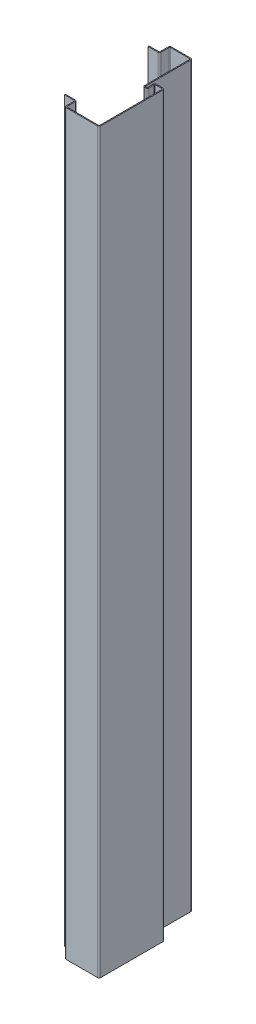
from build123d import *

# Parameters (mm, degrees)
BASE_FLANGE1_DEPTH = 490.75


# Sheet-metal steps are written as plain solids
with BuildPart() as part:
    # Sketch1 → Base-Flange1 (new, symmetric)
    with BuildSketch(Plane(origin=(0, 0, 0), x_dir=(1, 0, 0), z_dir=(0, 1, 0))):
        with BuildLine():
            Line((-4.25, 57.25), (8.7634, 57.25))
            ThreePointArc((8.7634, 57.25), (9.284254855, 57.465745145), (9.5, 57.9866))
            Line((9.5, 57.9866), (9.5, 69.0134))
            ThreePointArc((9.5, 69.0134), (10.081861668, 70.418138332), (11.4866, 71))
            Line((11.4866, 71), (37.5134, 71))
            ThreePointArc((37.5134, 71), (38.918138332, 70.418138332), (39.5, 69.0134))
            Line((39.5, 69.0134), (39.5, 17))
            Line((39.5, 17), (39.5, 8.562771629))
            ThreePointArc((39.5, 8.562771629), (39.724914644, 8.032905932), (40.262306969, 7.826620346))
            Line((40.262306969, 7.826620346), (42.153527557, 7.892663224))
            ThreePointArc((42.153527557, 7.892663224), (42.675221066, 8.135932903), (42.862626267, 8.680197126))
            Line((42.862626267, 8.680197126), (42.359529101, 15.874821789))
            ThreePointArc((42.359529101, 15.874821789), (42.88838258, 17.368257942), (44.341289843, 18))
            Line((44.341289843, 18), (53.5134, 18))
            ThreePointArc((53.5134, 18), (54.918138332, 17.418138332), (55.5, 16.0134))
            Line((55.5, 16.0134), (55.5, -22))
            Line((55.5, -22), (55.5, -67.0134))
            ThreePointArc((55.5, -67.0134), (54.918138332, -68.418138332), (53.5134, -69))
            Line((53.5134, -69), (39.5, -69))
            Line((39.5, -69), (11.4866, -69))
            ThreePointArc((11.4866, -69), (10.081861668, -68.418138332), (9.5, -67.0134))
            Line((9.5, -67.0134), (9.5, -55.9866))
            ThreePointArc((9.5, -55.9866), (9.284254855, -55.465745145), (8.7634, -55.25))
            Line((8.7634, -55.25), (-4.25, -55.25))
            Line((-4.25, -55.25), (-4.25, -54))
            Line((-4.25, -54), (8.7634, -54))
            ThreePointArc((8.7634, -54), (10.168138332, -54.581861668), (10.75, -55.9866))
            Line((10.75, -55.9866), (10.75, -67.0134))
            ThreePointArc((10.75, -67.0134), (10.965745145, -67.534254855), (11.4866, -67.75))
            Line((11.4866, -67.75), (39.5, -67.75))
            Line((39.5, -67.75), (53.5134, -67.75))
            ThreePointArc((53.5134, -67.75), (54.034254855, -67.534254855), (54.25, -67.0134))
            Line((54.25, -67.0134), (54.25, -22))
            Line((54.25, -22), (54.25, 16.0134))
            ThreePointArc((54.25, 16.0134), (54.034254855, 16.534254855), (53.5134, 16.75))
            Line((53.5134, 16.75), (44.341289843, 16.75))
            ThreePointArc((44.341289843, 16.75), (43.802574707, 16.515759992), (43.606484164, 15.962017381))
            Line((43.606484164, 15.962017381), (44.10958133, 8.767392718))
            ThreePointArc((44.10958133, 8.767392718), (43.604152098, 7.299519645), (42.197151928, 6.64342469))
            Line((42.197151928, 6.64342469), (40.30593134, 6.577381812))
            ThreePointArc((40.30593134, 6.577381812), (38.856591681, 7.133731182), (38.25, 8.562771629))
            Line((38.25, 8.562771629), (38.25, 17))
            Line((38.25, 17), (38.25, 69.0134))
            ThreePointArc((38.25, 69.0134), (38.034254855, 69.534254855), (37.5134, 69.75))
            Line((37.5134, 69.75), (11.4866, 69.75))
            ThreePointArc((11.4866, 69.75), (10.965745145, 69.534254855), (10.75, 69.0134))
            Line((10.75, 69.0134), (10.75, 57.9866))
            ThreePointArc((10.75, 57.9866), (10.168138332, 56.581861668), (8.7634, 56))
            Line((8.7634, 56), (-4.25, 56))
            Line((-4.25, 56), (-4.25, 57.25))
        make_face()
    extrude(amount=BASE_FLANGE1_DEPTH, both=True)


solid = part.part
